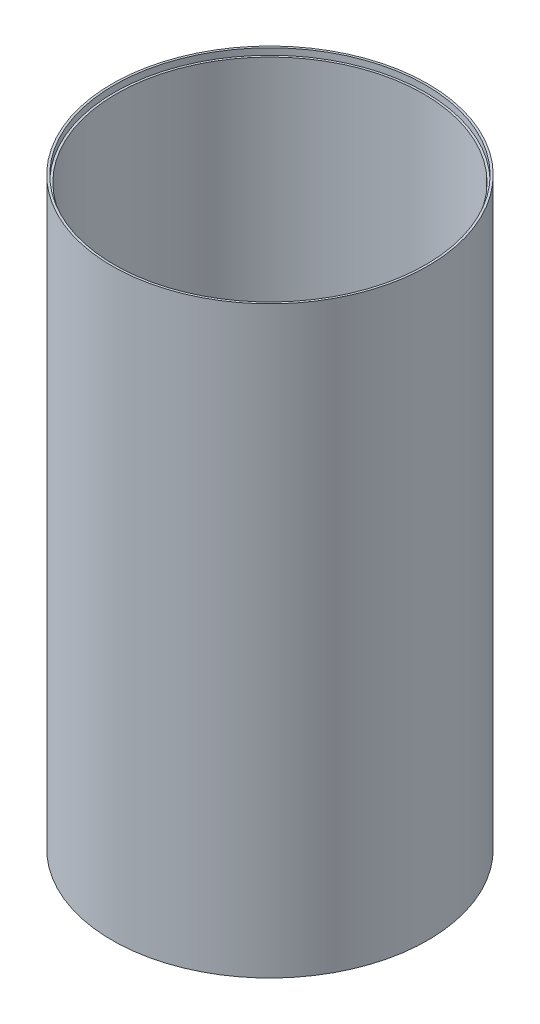
from build123d import *


with BuildPart() as part:
    # Schizzo1 → Rivoluzione1 (revolve)
    with BuildSketch(Plane.XY):
        Polygon((-72, 0), (-72, 3), (-71, 3), (-71, 267), (-72, 267), (-72, 270), (-73, 270), (-73, 0), align=None)
    revolve(axis=Axis((0, 0, 0), (0, 1, 0)))


solid = part.part
